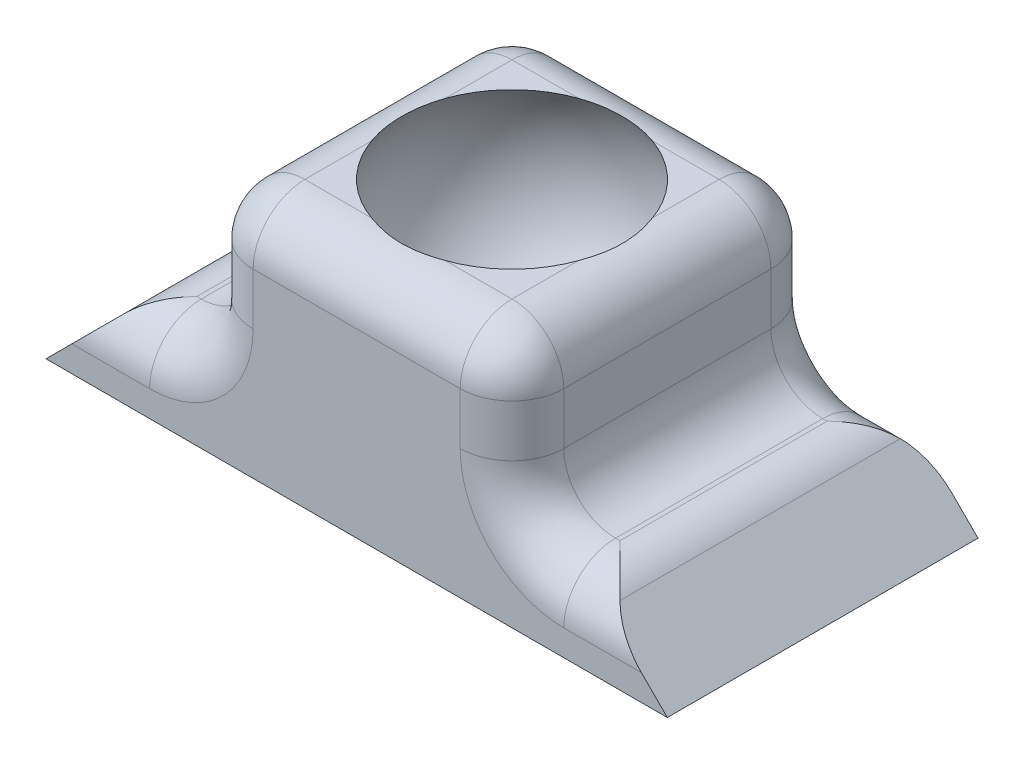
from build123d import *

# Parameters (mm, degrees)
BOSS_EXTRUDE1_DEPTH      = 3
BOSS_EXTRUDE1_DEPTH_BACK = 3
FILLET1_R                = 1


with BuildPart() as part:
    # Sketch1 → Boss-Extrude1 (new, two sides: drawn at the far end of the back side and taken through both)
    with BuildSketch(Plane.XY.offset(-BOSS_EXTRUDE1_DEPTH_BACK)):
        Polygon((-6, 0), (0, 0), (0, 4.5), (-3, 4.5), (-3, 1.5), (-4.5, 1.5), align=None)
        Polygon((0, 0), (6, 0), (4.5, 1.5), (3, 1.5), (3, 4.5), (0, 4.5), align=None)
    extrude(amount=BOSS_EXTRUDE1_DEPTH + BOSS_EXTRUDE1_DEPTH_BACK)

    # Sketch2 → Cut-Revolve1 (revolve, cut)
    with BuildSketch(Plane(origin=(0, 0, 0), x_dir=(0, 0, -1), z_dir=(1, 0, 0))):
        with BuildLine():
            Line((0, 0.4), (0, 5.6))
            ThreePointArc((0, 5.6), (-2.6, 3), (0, 0.4))
        make_face()
    revolve(axis=Axis((0, 0.4, 0), (0, 1, 0)), mode=Mode.SUBTRACT)

    # Fillet1
    # the kernel refuses this fillet: 1 mm, written as the material it adds along each edge
    with BuildSketch(Plane(origin=(-3, 1.5, 3), x_dir=(-1, 0, 0), z_dir=(0, 0, -1)), Plane(origin=(3, 1.5, -3), x_dir=(1, 0, 0), z_dir=(0, 0, 1))) as fillet1_piece_1:
        with BuildLine():
            CenterArc((FILLET1_R, FILLET1_R), FILLET1_R, 180, 90)
            Line((0, FILLET1_R), (0, 0))
            Line((0, 0), (FILLET1_R, 0))
        make_face()
    extrude(amount=6)
    # the kernel refuses this fillet: 1 mm, written as the material it takes off along each edge
    with BuildSketch(Plane(origin=(-2, 3.5, -2), x_dir=(-1, 0, 0), z_dir=(0, 1, 0))) as fillet1_2_piece_1_section:
        Polygon((0, 0), (FILLET1_R, 0), (FILLET1_R, -FILLET1_R), (0, -FILLET1_R), align=None)
    fillet1_2_piece_1 = extrude(amount=FILLET1_R, mode=Mode.PRIVATE)
    fillet1_2_piece_1 = fillet1_2_piece_1 - Plane(origin=(-2, 3.5, -2), x_dir=(0.7071067811865475, 0, 0.7071067811865475), z_dir=(0, 1, 0)) * Sphere(FILLET1_R, mode=Mode.PRIVATE)
    add(fillet1_2_piece_1, mode=Mode.SUBTRACT)
    with BuildSketch(Plane(origin=(-2, 3.5, 2), x_dir=(-1, 0, 0), z_dir=(0, 1, 0))) as fillet1_2_piece_2_section:
        Polygon((0, 0), (FILLET1_R, 0), (FILLET1_R, FILLET1_R), (0, FILLET1_R), align=None)
    fillet1_2_piece_2 = extrude(amount=FILLET1_R, mode=Mode.PRIVATE)
    fillet1_2_piece_2 = fillet1_2_piece_2 - Plane(origin=(-2, 3.5, 2), x_dir=(0.7071067811865475, 0, -0.7071067811865475), z_dir=(0, 1, 0)) * Sphere(FILLET1_R, mode=Mode.PRIVATE)
    add(fillet1_2_piece_2, mode=Mode.SUBTRACT)
    with BuildSketch(Plane(origin=(2, 3.5, -2), x_dir=(0, 0, -1), z_dir=(0, 1, 0))) as fillet1_2_piece_3_section:
        Polygon((0, 0), (FILLET1_R, 0), (FILLET1_R, -FILLET1_R), (0, -FILLET1_R), align=None)
    fillet1_2_piece_3 = extrude(amount=FILLET1_R, mode=Mode.PRIVATE)
    fillet1_2_piece_3 = fillet1_2_piece_3 - Plane(origin=(2, 3.5, -2), x_dir=(-0.7071067811865475, 0, 0.7071067811865475), z_dir=(0, 1, 0)) * Sphere(FILLET1_R, mode=Mode.PRIVATE)
    add(fillet1_2_piece_3, mode=Mode.SUBTRACT)
    with BuildSketch(Plane(origin=(2, 3.5, 2), x_dir=(0, 0, 1), z_dir=(0, 1, 0))) as fillet1_2_piece_4_section:
        Polygon((0, 0), (FILLET1_R, 0), (FILLET1_R, FILLET1_R), (0, FILLET1_R), align=None)
    fillet1_2_piece_4 = extrude(amount=FILLET1_R, mode=Mode.PRIVATE)
    fillet1_2_piece_4 = fillet1_2_piece_4 - Plane(origin=(2, 3.5, 2), x_dir=(-0.7071067811865475, 0, -0.7071067811865475), z_dir=(0, 1, 0)) * Sphere(FILLET1_R, mode=Mode.PRIVATE)
    add(fillet1_2_piece_4, mode=Mode.SUBTRACT)
    with BuildSketch(Plane(origin=(7, 1.5, -3), x_dir=(0, -1, 0), z_dir=(-1, 0, 0)), Plane(origin=(-4, 1.5, -3), x_dir=(0, -1, 0), z_dir=(-1, 0, 0))) as fillet1_2_piece_5:
        with BuildLine():
            CenterArc((FILLET1_R, FILLET1_R), FILLET1_R, 180, 90)
            Line((0, FILLET1_R), (0, 0))
            Line((0, 0), (FILLET1_R, 0))
        make_face()
    extrude(amount=3, mode=Mode.SUBTRACT)
    with BuildSketch(Plane(origin=(-4.5, 1.5, 4.035533906), x_dir=(-0.7071067811865516, -0.7071067811865435, 0), z_dir=(0, 0, -1)), Plane(origin=(4.5, 1.5, -4.035533906), x_dir=(0.707106781186551, -0.707106781186544, 0), z_dir=(0, 0, 1))) as fillet1_2_piece_6:
        with BuildLine():
            CenterArc((FILLET1_R * 0.414213562373, -FILLET1_R), FILLET1_R, 90, 45)
            Line((-FILLET1_R * 0.292893218813, -FILLET1_R * 0.292893218813), (0, 0))
            Line((0, 0), (FILLET1_R * 0.414213562373, 0))
        make_face()
    extrude(amount=8.071067812, mode=Mode.SUBTRACT)
    with BuildSketch(Plane(origin=(-3, 4.5, -2), x_dir=(1, 0, 0), z_dir=(0, 0, 1)), Plane(origin=(3, 4.5, -2), x_dir=(0, -1, 0), z_dir=(0, 0, 1)), Plane(origin=(-2, 4.5, -3), x_dir=(0, -1, 0), z_dir=(1, 0, 0)), Plane(origin=(2, 4.5, 3), x_dir=(0, -1, 0), z_dir=(-1, 0, 0))) as fillet1_2_piece_7:
        with BuildLine():
            CenterArc((FILLET1_R, -FILLET1_R), FILLET1_R, 90, 90)
            Line((0, -FILLET1_R), (0, 0))
            Line((0, 0), (FILLET1_R, 0))
        make_face()
    extrude(amount=4, mode=Mode.SUBTRACT)
    with BuildSketch(Plane(origin=(3, 2.5, -3), x_dir=(-1, 0, 0), z_dir=(0, 1, 0)), Plane(origin=(-3, 3.5, -3), x_dir=(1, 0, 0), z_dir=(0, -1, 0))) as fillet1_2_piece_8:
        with BuildLine():
            CenterArc((FILLET1_R, FILLET1_R), FILLET1_R, 180, 90)
            Line((0, FILLET1_R), (0, 0))
            Line((0, 0), (FILLET1_R, 0))
        make_face()
    extrude(amount=1, mode=Mode.SUBTRACT)
    with BuildSketch(Plane(origin=(-3, 3.5, 3), x_dir=(1, 0, 0), z_dir=(0, -1, 0)), Plane(origin=(3, 2.5, 3), x_dir=(-1, 0, 0), z_dir=(0, 1, 0))) as fillet1_2_piece_9:
        with BuildLine():
            CenterArc((FILLET1_R, -FILLET1_R), FILLET1_R, 90, 90)
            Line((0, -FILLET1_R), (0, 0))
            Line((0, 0), (FILLET1_R, 0))
        make_face()
    extrude(amount=1, mode=Mode.SUBTRACT)
    with BuildSketch(Plane(origin=(-4, 1.5, 3), x_dir=(0, -1, 0), z_dir=(-1, 0, 0)), Plane(origin=(7, 1.5, 3), x_dir=(0, -1, 0), z_dir=(-1, 0, 0))) as fillet1_2_piece_10:
        with BuildLine():
            CenterArc((FILLET1_R, -FILLET1_R), FILLET1_R, 90, 90)
            Line((0, -FILLET1_R), (0, 0))
            Line((0, 0), (FILLET1_R, 0))
        make_face()
    extrude(amount=3, mode=Mode.SUBTRACT)
    with BuildSketch(Plane(origin=(-4, 2.5, -3), x_dir=(0, -1, 0), z_dir=(-1, 0, 0))) as fillet1_2_piece_11:
        with BuildLine():
            CenterArc((1 + FILLET1_R, FILLET1_R), FILLET1_R, 180, 90)
            Line((1, FILLET1_R), (1, 0))
            Line((1, 0), (1 + FILLET1_R, 0))
        make_face()
    revolve(axis=Axis((-4, 2.5, -3), (0, 0, 1)), revolution_arc=90, mode=Mode.SUBTRACT)
    with BuildSketch(Plane(origin=(4, 2.5, 3), x_dir=(0, -1, 0), z_dir=(1, 0, 0))) as fillet1_2_piece_12:
        with BuildLine():
            CenterArc((1 + FILLET1_R, FILLET1_R), FILLET1_R, 180, 90)
            Line((1, FILLET1_R), (1, 0))
            Line((1, 0), (1 + FILLET1_R, 0))
        make_face()
    revolve(axis=Axis((4, 2.5, 3), (0, 0, -1)), revolution_arc=90, mode=Mode.SUBTRACT)
    with BuildSketch(Plane(origin=(-4, 2.5, 3), x_dir=(0, -1, 0), z_dir=(-1, 0, 0))) as fillet1_2_piece_13:
        with BuildLine():
            CenterArc((1 + FILLET1_R, -FILLET1_R), FILLET1_R, 90, 90)
            Line((1, -FILLET1_R), (1, 0))
            Line((1, 0), (1 + FILLET1_R, 0))
        make_face()
    revolve(axis=Axis((-4, 2.5, 3), (0, 0, 1)), revolution_arc=90, mode=Mode.SUBTRACT)
    with BuildSketch(Plane(origin=(4, 2.5, -3), x_dir=(0, -1, 0), z_dir=(1, 0, 0))) as fillet1_2_piece_14:
        with BuildLine():
            CenterArc((1 + FILLET1_R, -FILLET1_R), FILLET1_R, 90, 90)
            Line((1, -FILLET1_R), (1, 0))
            Line((1, 0), (1 + FILLET1_R, 0))
        make_face()
    revolve(axis=Axis((4, 2.5, -3), (0, 0, -1)), revolution_arc=90, mode=Mode.SUBTRACT)


solid = part.part
